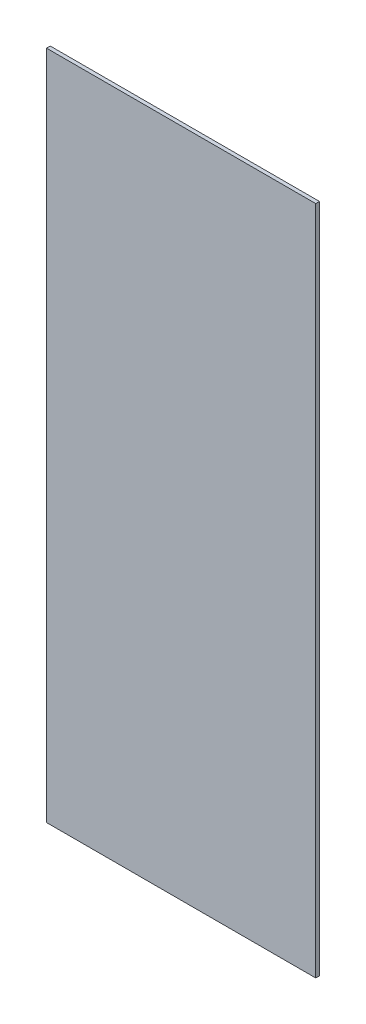
from build123d import *

# Parameters (mm, degrees)
SKETCH1_W           = 229.419616736
SKETCH1_H           = 571.5
BOSS_EXTRUDE1_DEPTH = 3.175


with BuildPart() as part:
    # Sketch1 → Boss-Extrude1 (new body)
    with BuildSketch(Plane.XY):
        with Locations((114.709808368, 285.75)):
            Rectangle(SKETCH1_W, SKETCH1_H)
    extrude(amount=BOSS_EXTRUDE1_DEPTH)


solid = part.part
